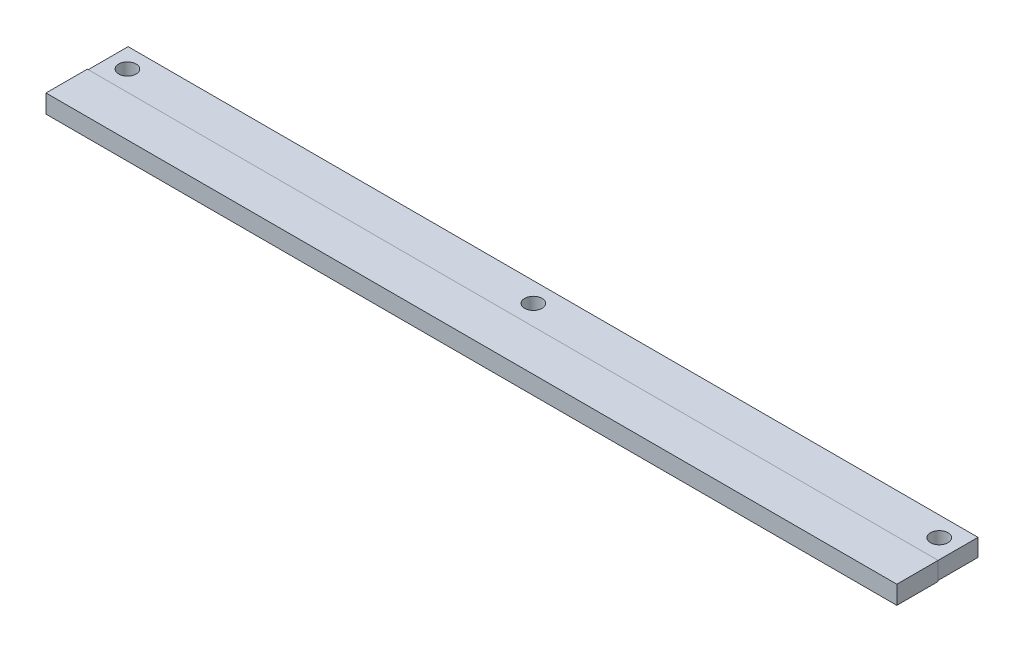
from build123d import *

# Parameters (mm, degrees)
SKETCH1_W           = 4
SKETCH1_H           = 185.5
BOSS_EXTRUDE1_DEPTH = 18
CUT_EXTRUDE1_REACH  = 188.414
SKETCH2_R           = 1.9
LPATTERN1_COUNT     = 3
LPATTERN1_PITCH     = 88.5
SKETCH3_W           = 185.5
SKETCH3_H           = 4
SKETCH3_W_2         = 185.3
SKETCH3_H_2         = 3.8
CUT_EXTRUDE2_DEPTH  = 9
CUT_EXTRUDE3_REACH  = 188.412
SKETCH5_W           = 185.3
SKETCH5_H           = 0.2


with BuildPart() as part:
    # Sketch1 → Boss-Extrude1 (new body)
    with BuildSketch(Plane(origin=(0, 0, 0), x_dir=(0, 1, 0), z_dir=(0, 0, 1))):
        with Locations((2, 92.75)):
            Rectangle(SKETCH1_W, SKETCH1_H)
    extrude(amount=BOSS_EXTRUDE1_DEPTH)

    # Sketch2 → Cut-Extrude1 (cut, up to next)
    with BuildSketch(Plane(origin=(0, 4, 0), x_dir=(-1, 0, 0), z_dir=(0, 1, 0)), mode=Mode.PRIVATE) as cut_extrude1_sk1:
        with Locations((181.25, 4.5)):
            Circle(SKETCH2_R)
    cut_extrude1_tool1 = extrude(cut_extrude1_sk1.sketch, amount=-CUT_EXTRUDE1_REACH, mode=Mode.PRIVATE) & part.part
    cut_extrude1 = cut_extrude1_tool1.solids().sort_by_distance((-181.25, 4, 4.5))[0]
    add(cut_extrude1, mode=Mode.SUBTRACT)

    # LPattern1: Cut-Extrude1 ×3
    with Locations(*[(i * LPATTERN1_PITCH, 0, 0) for i in range(1, LPATTERN1_COUNT)]):
        add(cut_extrude1, mode=Mode.SUBTRACT)

    # Sketch3 → Cut-Extrude2 (cut)
    with BuildSketch(Plane(origin=(0, 0, 0), x_dir=(1, 0, 0), z_dir=(0, 0, -1))):
        with Locations((-92.75, -2)):
            Rectangle(SKETCH3_W, SKETCH3_H)
        with Locations((-92.75, -2)):
            Rectangle(SKETCH3_W_2, SKETCH3_H_2, mode=Mode.SUBTRACT)
    extrude(amount=-CUT_EXTRUDE2_DEPTH, mode=Mode.SUBTRACT)

    # Sketch5 → Cut-Extrude3 (cut, up to next)
    with BuildSketch(Plane(origin=(0, 3.9, 0), x_dir=(-1, 0, 0), z_dir=(0, 1, 0)), mode=Mode.PRIVATE) as cut_extrude3_sk1:
        with Locations((92.75, 0.1)):
            Rectangle(SKETCH5_W, SKETCH5_H)
    cut_extrude3_tool1 = extrude(cut_extrude3_sk1.sketch, amount=-CUT_EXTRUDE3_REACH, mode=Mode.PRIVATE) & part.part
    add(cut_extrude3_tool1.solids().sort_by_distance((-92.75, 3.9, 0.1))[0], mode=Mode.SUBTRACT)


solid = part.part
